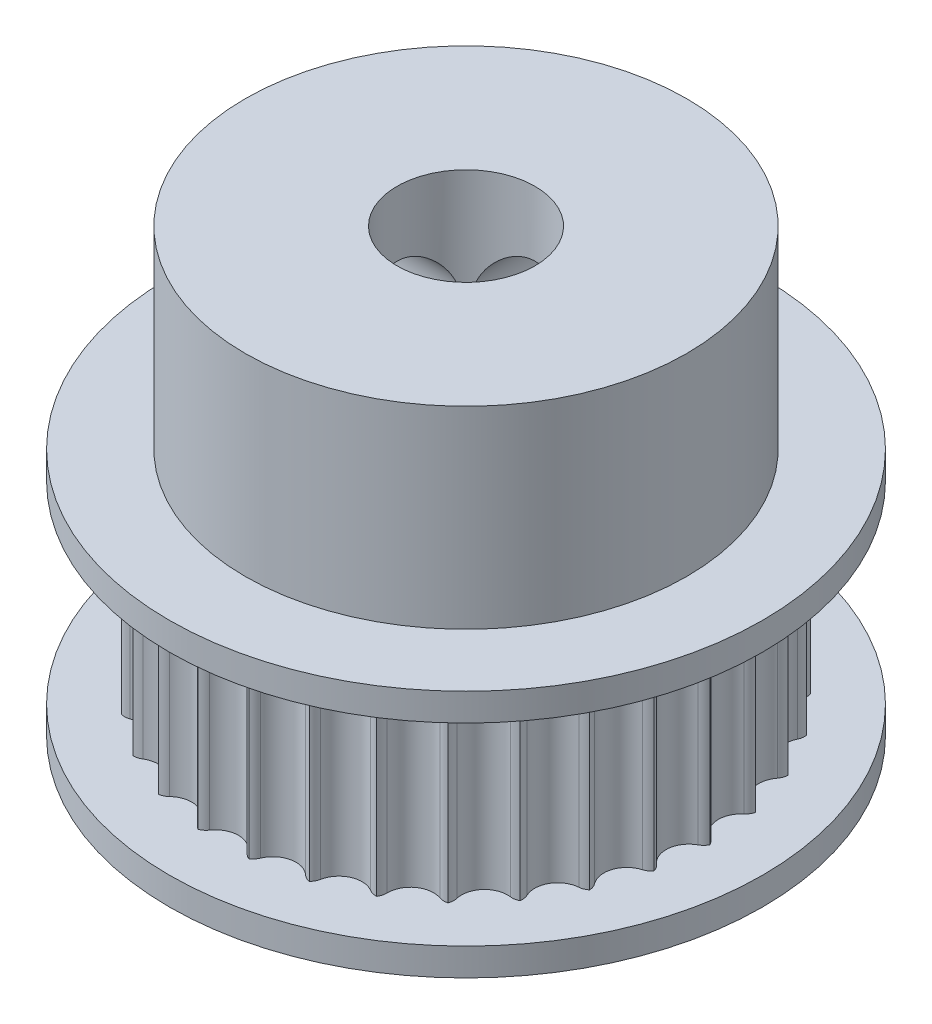
from build123d import *

# Parameters (mm, degrees)
CUT_EXTRUDE1_DEPTH      = 7
CIRPATTERN1_COUNT       = 30
CUT_EXTRUDE2_REACH      = 19.418
CUT_EXTRUDE2_END_RADIUS = 8
SKETCH3_R               = 1.65
CUT_EXTRUDE3_REACH      = 19.418
CUT_EXTRUDE3_END_RADIUS = 8
SKETCH4_R               = 1.65
CHAMFER1_SIZE           = 1


with BuildPart() as part:
    # Skica2 → Revolute (revolve)
    with BuildSketch(Plane.XY):
        Polygon((8, 8.5), (2.5, 8.5), (2.5, -8.5), (6.11, -8.5), (6.11, -7.5), (10.75, -7.5), (10.75, -6.5), (9.25, -6.5), (9.25, 0.5), (10.75, 0.5), (10.75, 1.5), (8, 1.5), align=None)
    revolve(axis=Axis((0, -8.5, 0), (0, 1, 0)))

    # Sketch2 → Cut-Extrude1 (cut)
    with BuildSketch(Plane.XZ.offset(-0.5)):
        with BuildLine():
            ThreePointArc((-0.688149825, 8.608192332), (0, 8.246880311), (0.688149825, 8.608192332))
            ThreePointArc((0.688149825, 8.608192332), (0.896854633, 8.78128412), (1.165221066, 8.819987111))
            ThreePointArc((1.165221066, 8.819987111), (1.389669154, 8.787418985), (1.61321413, 8.749140126))
            ThreePointArc((1.61321413, 8.749140126), (1.215542466, 9.923600007), (0, 10.168457672))
            ThreePointArc((0, 10.168457672), (-1.215542466, 9.923600007), (-1.61321413, 8.749140126))
            ThreePointArc((-1.61321413, 8.749140126), (-1.389669154, 8.787418985), (-1.165221066, 8.819987111))
            ThreePointArc((-1.165221066, 8.819987111), (-0.896854633, 8.78128412), (-0.688149825, 8.608192332))
        make_face()
    cut_extrude1 = extrude(amount=CUT_EXTRUDE1_DEPTH, mode=Mode.SUBTRACT)

    # CirPattern1: Cut-Extrude1 ×30 about axis
    cirpattern1_axis = Axis((0, 0, 0), (0, 1, 0))
    for i in range(1, CIRPATTERN1_COUNT):
        add(cut_extrude1.rotate(cirpattern1_axis, i * 360 / CIRPATTERN1_COUNT), mode=Mode.SUBTRACT)

    # Cut-Extrude2: up to this cylinder (the profile starts inside it)
    cut_extrude2_end = Plane(origin=(0, 4.5, 0), z_dir=(0, -1, 0)) * Cylinder(CUT_EXTRUDE2_END_RADIUS, 55.836, mode=Mode.PRIVATE)
    # Sketch3 → Cut-Extrude2 (cut, up to the surface)
    with BuildSketch(Plane(origin=(0, 0, 0), x_dir=(0, 0, -1), z_dir=(1, 0, 0)), mode=Mode.PRIVATE) as cut_extrude2_sk1:
        with Locations((0, 4.5)):
            Circle(SKETCH3_R)
    cut_extrude2_tool1 = extrude(cut_extrude2_sk1.sketch, amount=-CUT_EXTRUDE2_REACH, mode=Mode.PRIVATE) & cut_extrude2_end
    add(cut_extrude2_tool1.solids().sort_by_distance((0, 4.5, 0))[0], mode=Mode.SUBTRACT)

    # Cut-Extrude3: up to this cylinder (the profile starts inside it)
    cut_extrude3_end = Plane(origin=(0, 4.5, 0), z_dir=(0, -1, 0)) * Cylinder(CUT_EXTRUDE3_END_RADIUS, 55.836, mode=Mode.PRIVATE)
    # Sketch4 → Cut-Extrude3 (cut, up to the surface)
    with BuildSketch(Plane.XY, mode=Mode.PRIVATE) as cut_extrude3_sk1:
        with Locations((0, 4.5)):
            Circle(SKETCH4_R)
    cut_extrude3_tool1 = extrude(cut_extrude3_sk1.sketch, amount=-CUT_EXTRUDE3_REACH, mode=Mode.PRIVATE) & cut_extrude3_end
    add(cut_extrude3_tool1.solids().sort_by_distance((0, 4.5, 0))[0], mode=Mode.SUBTRACT)

    # Chamfer1
    chamfer1_edges = [part.edges().sort_by_distance(p)[0] for p in [
        (-6.11, -7.5, 0),
    ]]
    chamfer(chamfer1_edges, length=CHAMFER1_SIZE - 0.0001)  # a hair under: the kernel refuses the full size


solid = part.part
